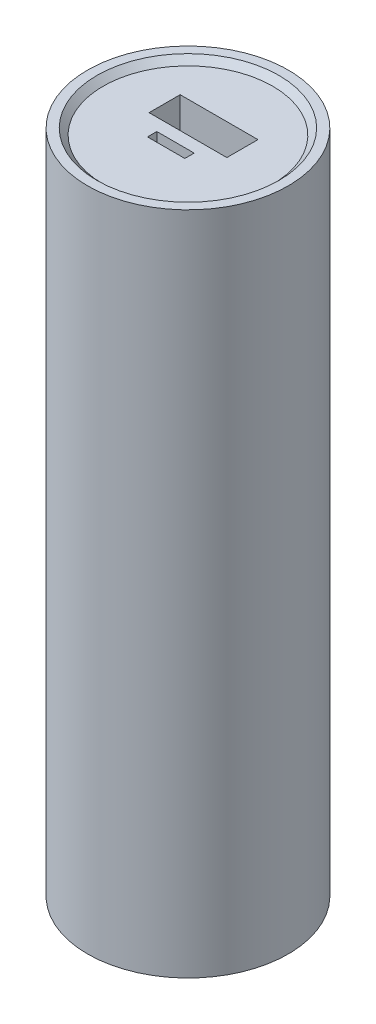
from build123d import *

# Parameters (mm, degrees)
SKETCH1_R           = 16.125
BOSS_EXTRUDE1_DEPTH = 106.9
SKETCH2_R           = 14.625
CUT_EXTRUDE1_DEPTH  = 1
CHAMFER1_SIZE       = 1
SKETCH3_W           = 12.5
SKETCH3_H           = 5
SKETCH3_W_2         = 6
SKETCH3_H_2         = 1.5
CUT_EXTRUDE2_DEPTH  = 5


with BuildPart() as part:
    # Sketch1 → Boss-Extrude1 (new body)
    with BuildSketch(Plane(origin=(0, 0, 0), x_dir=(1, 0, 0), z_dir=(0, 1, 0))):
        with Locations(Location((0, 0, 0), (0, 0, 270))):
            Circle(SKETCH1_R)
    extrude(amount=BOSS_EXTRUDE1_DEPTH)

    # Sketch2 → Cut-Extrude1 (cut)
    with BuildSketch(Plane(origin=(0, 106.9, 0), x_dir=(1, 0, 0), z_dir=(0, 1, 0))):
        with Locations(Location((0, 0, 0), (0, 0, 270))):
            Circle(SKETCH2_R)
    extrude(amount=-CUT_EXTRUDE1_DEPTH, mode=Mode.SUBTRACT)

    # Chamfer1
    chamfer1_edges = [part.edges().sort_by_distance(p)[0] for p in [
        (0, 105.9, -14.625),
    ]]
    chamfer(chamfer1_edges, length=CHAMFER1_SIZE - 0.0001)  # a hair under: the kernel refuses the full size

    # Sketch3 → Cut-Extrude2 (cut)
    with BuildSketch(Plane(origin=(0, 105.9, 0), x_dir=(1, 0, 0), z_dir=(0, 1, 0))):
        with Locations((0, 2.5)):
            Rectangle(SKETCH3_W, SKETCH3_H)
        with Locations((0, -2.75)):
            Rectangle(SKETCH3_W_2, SKETCH3_H_2)
    extrude(amount=-CUT_EXTRUDE2_DEPTH, mode=Mode.SUBTRACT)


solid = part.part
